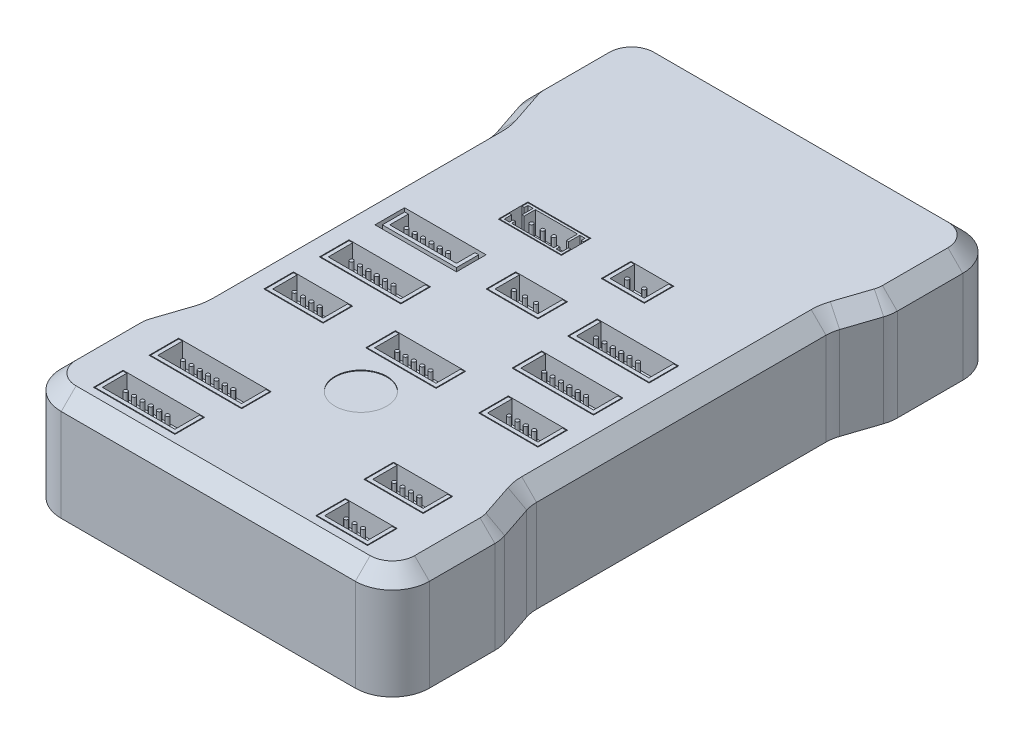
from build123d import *

# Parameters (mm, degrees)
BOSS_EXTRUDE1_DEPTH  = 16
CHAMFER2_SIZE        = 2
CHAMFER3_SIZE        = 3.5
CHAMFER3_SIZE2       = 1.5
CUT_EXTRUDE2_DEPTH   = 0.5
SKETCH5_W            = 8.5
SKETCH5_H            = 4
SKETCH5_W_2          = 5.8
SKETCH5_W_3          = 11
SKETCH5_W_4          = 7
SKETCH5_W_5          = 8
SKETCH5_W_6          = 9.5
SKETCH5_W_7          = 12.5
CUT_EXTRUDE3_DEPTH   = 4
BOSS_EXTRUDE2_DEPTH  = 4
SKETCH7_W            = 8.3
SKETCH7_H            = 3.8
BOSS_EXTRUDE3_DEPTH  = 1
SKETCH8_R            = 0.25
BOSS_EXTRUDE4_DEPTH  = 3
BOSS_EXTRUDE5_DEPTH  = 4
BOSS_EXTRUDE6_DEPTH  = 1
SKETCH11_R           = 0.25
BOSS_EXTRUDE7_DEPTH  = 3
SKETCH12_W           = 10
SKETCH12_H           = 3
BOSS_EXTRUDE8_DEPTH  = 1
BOSS_EXTRUDE9_DEPTH  = 3
SKETCH14_R           = 0.25
BOSS_EXTRUDE10_DEPTH = 3
SKETCH15_W           = 6.8
SKETCH15_H           = 3.8
BOSS_EXTRUDE11_DEPTH = 1
BOSS_EXTRUDE12_DEPTH = 3
SKETCH17_R           = 0.25
BOSS_EXTRUDE13_DEPTH = 3
SKETCH18_W           = 10.8
SKETCH18_H           = 3.8
BOSS_EXTRUDE14_DEPTH = 1
BOSS_EXTRUDE15_DEPTH = 3
SKETCH20_R           = 0.25
SKETCH20_R_2         = 0.247012806
SKETCH20_R_3         = 0.247012796
BOSS_EXTRUDE16_DEPTH = 3
SKETCH22_W           = 10.8
SKETCH22_H           = 3.8
BOSS_EXTRUDE17_DEPTH = 1
BOSS_EXTRUDE18_DEPTH = 3
SKETCH24_R           = 0.25
BOSS_EXTRUDE19_DEPTH = 3
SKETCH25_W           = 10.8
SKETCH25_H           = 3.8
BOSS_EXTRUDE20_DEPTH = 1
BOSS_EXTRUDE21_DEPTH = 3
SKETCH27_R           = 0.25
BOSS_EXTRUDE22_DEPTH = 3
SKETCH28_W           = 7.8
SKETCH28_H           = 3.8
BOSS_EXTRUDE23_DEPTH = 1
BOSS_EXTRUDE24_DEPTH = 3
SKETCH30_R           = 0.25
BOSS_EXTRUDE25_DEPTH = 3
SKETCH31_W           = 9.3
SKETCH31_H           = 3.8
BOSS_EXTRUDE26_DEPTH = 1
BOSS_EXTRUDE27_DEPTH = 3
SKETCH33_R           = 0.25
BOSS_EXTRUDE28_DEPTH = 3
SKETCH34_W           = 7.8
SKETCH34_H           = 3.8
BOSS_EXTRUDE29_DEPTH = 1
BOSS_EXTRUDE30_DEPTH = 3
SKETCH36_R           = 0.25
BOSS_EXTRUDE31_DEPTH = 3
SKETCH37_W           = 12.3
SKETCH37_H           = 3.8
BOSS_EXTRUDE32_DEPTH = 1
BOSS_EXTRUDE33_DEPTH = 3
SKETCH39_R           = 0.25
BOSS_EXTRUDE34_DEPTH = 3
SKETCH40_W           = 7.8
SKETCH40_H           = 3.8
BOSS_EXTRUDE35_DEPTH = 1
BOSS_EXTRUDE36_DEPTH = 3
SKETCH42_R           = 0.25
BOSS_EXTRUDE37_DEPTH = 3
SKETCH43_W           = 10.8
SKETCH43_H           = 3.8
BOSS_EXTRUDE38_DEPTH = 1
BOSS_EXTRUDE39_DEPTH = 3
SKETCH45_R           = 0.25
BOSS_EXTRUDE40_DEPTH = 3
SKETCH46_W           = 6.8
SKETCH46_H           = 3.8
BOSS_EXTRUDE41_DEPTH = 1
BOSS_EXTRUDE42_DEPTH = 3
SKETCH48_R           = 0.25
BOSS_EXTRUDE43_DEPTH = 3
SKETCH49_R           = 3.5
CUT_EXTRUDE4_DEPTH   = 0.1
SKETCH51_W           = 39.7
SKETCH51_H           = 9
CUT_EXTRUDE5_DEPTH   = 7
SKETCH52_R           = 0.25
BOSS_EXTRUDE46_DEPTH = 7
L_EK1_SCALE          = 0.5


with BuildPart() as part:
    # Sketch1 → Boss-Extrude1 (new body)
    with BuildSketch(Plane(origin=(0, 0, 0), x_dir=(1, 0, 0), z_dir=(0, 1, 0))):
        with BuildLine():
            Line((-19.85, 41), (19.85, 41))
            ThreePointArc((19.85, 41), (23.385533906, 39.535533906), (24.85, 36))
            Line((24.85, 36), (24.85, 27.161388301))
            ThreePointArc((24.85, 27.161388301), (24.785437288, 26.360477086), (24.59341649, 25.580249471))
            Line((24.59341649, 25.580249471), (23.10658351, 21.119750529))
            ThreePointArc((23.10658351, 21.119750529), (22.914562712, 20.339522914), (22.85, 19.538611699))
            Line((22.85, 19.538611699), (22.85, -19.538611699))
            ThreePointArc((22.85, -19.538611699), (22.914562712, -20.339522914), (23.10658351, -21.119750529))
            Line((23.10658351, -21.119750529), (24.59341649, -25.580249471))
            ThreePointArc((24.59341649, -25.580249471), (24.785437288, -26.360477086), (24.85, -27.161388301))
            Line((24.85, -27.161388301), (24.85, -36))
            ThreePointArc((24.85, -36), (23.385533906, -39.535533906), (19.85, -41))
            Line((19.85, -41), (-19.85, -41))
            ThreePointArc((-19.85, -41), (-23.385533906, -39.535533906), (-24.85, -36))
            Line((-24.85, -36), (-24.85, -27.161388301))
            ThreePointArc((-24.85, -27.161388301), (-24.785437288, -26.360477086), (-24.59341649, -25.580249471))
            Line((-24.59341649, -25.580249471), (-23.10658351, -21.119750529))
            ThreePointArc((-23.10658351, -21.119750529), (-22.914562712, -20.339522914), (-22.85, -19.538611699))
            Line((-22.85, -19.538611699), (-22.85, 19.538611699))
            ThreePointArc((-22.85, 19.538611699), (-22.914562712, 20.339522914), (-23.10658351, 21.119750529))
            Line((-23.10658351, 21.119750529), (-24.59341649, 25.580249471))
            ThreePointArc((-24.59341649, 25.580249471), (-24.785437288, 26.360477086), (-24.85, 27.161388301))
            Line((-24.85, 27.161388301), (-24.85, 36))
            ThreePointArc((-24.85, 36), (-23.385533906, 39.535533906), (-19.85, 41))
        make_face()
    extrude(amount=BOSS_EXTRUDE1_DEPTH)

    # Chamfer2
    chamfer2_edges = [part.edges().sort_by_distance(p)[0] for p in [
        (22.914562712, 16, 20.339522914),
        (22.85, 16, 0),
        (23.85, 16, 23.35),
        (22.914562712, 16, -20.339522914),
        (24.785437288, 16, 26.360477086),
        (23.85, 16, -23.35),
        (24.85, 16, 31.58069415),
        (24.785437288, 16, -26.360477086),
        (23.385533906, 16, 39.535533906),
        (24.85, 16, -31.58069415),
        (0, 16, 41),
        (23.385533906, 16, -39.535533906),
        (-23.385533906, 16, 39.535533906),
        (0, 16, -41),
        (-24.85, 16, 31.58069415),
        (-23.385533906, 16, -39.535533906),
        (-24.785437288, 16, 26.360477086),
        (-24.85, 16, -31.58069415),
        (-23.85, 16, 23.35),
        (-24.785437288, 16, -26.360477086),
        (-22.914562712, 16, 20.339522914),
        (-23.85, 16, -23.35),
        (-22.85, 16, 0),
        (-22.914562712, 16, -20.339522914),
    ]]
    chamfer(chamfer2_edges, length=CHAMFER2_SIZE)

    # Chamfer3
    chamfer3_edges = [part.edges().sort_by_distance(p)[0] for p in [
        (24.85, 0, -31.58069415),
        (24.785437288, 0, -26.360477086),
        (23.85, 0, -23.35),
        (22.914562712, 0, -20.339522914),
        (22.85, 0, 0),
        (22.914562712, 0, 20.339522914),
        (23.85, 0, 23.35),
        (24.785437288, 0, 26.360477086),
        (24.85, 0, 31.58069415),
        (23.385533906, 0, 39.535533906),
        (0, 0, 41),
        (-23.385533906, 0, 39.535533906),
        (-24.85, 0, 31.58069415),
        (-24.785437288, 0, 26.360477086),
        (-23.85, 0, 23.35),
        (-22.914562712, 0, 20.339522914),
        (-22.85, 0, 0),
        (-22.914562712, 0, -20.339522914),
        (-23.85, 0, -23.35),
        (-24.785437288, 0, -26.360477086),
        (-24.85, 0, -31.58069415),
        (-23.385533906, 0, -39.535533906),
        (0, 0, -41),
        (23.385533906, 0, -39.535533906),
    ]]
    chamfer3_side = [part.faces().sort_by_distance(p)[0] for p in [
        (0, 0, 0),
    ]]
    chamfer(chamfer3_edges, length=CHAMFER3_SIZE, length2=CHAMFER3_SIZE2, reference=chamfer3_side[0])

    # Sketch4 → Cut-Extrude2 (cut)
    with BuildSketch(Plane.XZ):
        with BuildLine():
            Line((-18.35, 36.5), (-12.35, 36.5))
            ThreePointArc((-12.35, 36.5), (-10.935786438, 35.914213562), (-10.35, 34.5))
            Line((-10.35, 34.5), (-10.35, 28.5))
            ThreePointArc((-10.35, 28.5), (-10.935786438, 27.085786438), (-12.35, 26.5))
            Line((-12.35, 26.5), (-18.35, 26.5))
            ThreePointArc((-18.35, 26.5), (-19.764213562, 27.085786438), (-20.35, 28.5))
            Line((-20.35, 28.5), (-20.35, 34.5))
            ThreePointArc((-20.35, 34.5), (-19.764213562, 35.914213562), (-18.35, 36.5))
        make_face()
        with BuildLine():
            Line((18.35, 26.5), (12.35, 26.5))
            ThreePointArc((12.35, 26.5), (10.935786438, 27.085786438), (10.35, 28.5))
            Line((10.35, 28.5), (10.35, 34.5))
            ThreePointArc((10.35, 34.5), (10.935786438, 35.914213562), (12.35, 36.5))
            Line((12.35, 36.5), (18.35, 36.5))
            ThreePointArc((18.35, 36.5), (19.764213562, 35.914213562), (20.35, 34.5))
            Line((20.35, 34.5), (20.35, 28.5))
            ThreePointArc((20.35, 28.5), (19.764213562, 27.085786438), (18.35, 26.5))
        make_face()
        with BuildLine():
            Line((20.35, -34.5), (20.35, -28.5))
            ThreePointArc((20.35, -28.5), (19.764213562, -27.085786438), (18.35, -26.5))
            Line((18.35, -26.5), (12.35, -26.5))
            ThreePointArc((12.35, -26.5), (10.935786438, -27.085786438), (10.35, -28.5))
            Line((10.35, -28.5), (10.35, -34.5))
            ThreePointArc((10.35, -34.5), (10.935786438, -35.914213562), (12.35, -36.5))
            Line((12.35, -36.5), (18.35, -36.5))
            ThreePointArc((18.35, -36.5), (19.764213562, -35.914213562), (20.35, -34.5))
        make_face()
        with BuildLine():
            Line((-18.35, -26.5), (-12.35, -26.5))
            ThreePointArc((-12.35, -26.5), (-10.935786438, -27.085786438), (-10.35, -28.5))
            Line((-10.35, -28.5), (-10.35, -34.5))
            ThreePointArc((-10.35, -34.5), (-10.935786438, -35.914213562), (-12.35, -36.5))
            Line((-12.35, -36.5), (-18.35, -36.5))
            ThreePointArc((-18.35, -36.5), (-19.764213562, -35.914213562), (-20.35, -34.5))
            Line((-20.35, -34.5), (-20.35, -28.5))
            ThreePointArc((-20.35, -28.5), (-19.764213562, -27.085786438), (-18.35, -26.5))
        make_face()
        with BuildLine():
            Line((-10.75, 17.75), (10.75, 17.75))
            ThreePointArc((10.75, 17.75), (12.164213562, 17.164213562), (12.75, 15.75))
            Line((12.75, 15.75), (12.75, -15.75))
            ThreePointArc((12.75, -15.75), (12.164213562, -17.164213562), (10.75, -17.75))
            Line((10.75, -17.75), (-10.75, -17.75))
            ThreePointArc((-10.75, -17.75), (-12.164213562, -17.164213562), (-12.75, -15.75))
            Line((-12.75, -15.75), (-12.75, 15.75))
            ThreePointArc((-12.75, 15.75), (-12.164213562, 17.164213562), (-10.75, 17.75))
        make_face()
    extrude(amount=-CUT_EXTRUDE2_DEPTH, mode=Mode.SUBTRACT)

    # Sketch5 → Cut-Extrude3 (cut)
    with BuildSketch(Plane(origin=(0, 16, 0), x_dir=(1, 0, 0), z_dir=(0, 1, 0))):
        with Locations((-6.6, 11)):
            Rectangle(SKETCH5_W, SKETCH5_H)
        with Locations((5.95, 11)):
            Rectangle(SKETCH5_W_2, SKETCH5_H)
        with Locations((-13, -5.5)):
            Rectangle(SKETCH5_W_3, SKETCH5_H)
        with Locations((-13, 2)):
            Rectangle(SKETCH5_W_3, SKETCH5_H)
        with Locations((0, 2)):
            Rectangle(SKETCH5_W_4, SKETCH5_H)
        with Locations((13, 2)):
            Rectangle(SKETCH5_W_3, SKETCH5_H)
        with Locations((13, -5.5)):
            Rectangle(SKETCH5_W_3, SKETCH5_H)
        with Locations((-14.5, -13)):
            Rectangle(SKETCH5_W_5, SKETCH5_H)
        with Locations((0, -13)):
            Rectangle(SKETCH5_W_6, SKETCH5_H)
        with Locations((14.5, -13)):
            Rectangle(SKETCH5_W_5, SKETCH5_H)
        with Locations((-13, -36)):
            Rectangle(SKETCH5_W_3, SKETCH5_H)
        with Locations((-12.25, -28.5)):
            Rectangle(SKETCH5_W_7, SKETCH5_H)
        with Locations((14.5, -28.5)):
            Rectangle(SKETCH5_W_5, SKETCH5_H)
        with Locations((15, -36)):
            Rectangle(SKETCH5_W_4, SKETCH5_H)
    extrude(amount=-CUT_EXTRUDE3_DEPTH, mode=Mode.SUBTRACT)

    # Sketch6 → Boss-Extrude2 (add)
    with BuildSketch(Plane(origin=(0, 12, 0), x_dir=(1, 0, 0), z_dir=(0, 1, 0))):
        Polygon((-9.75, 11.1), (-9.45, 11.1), (-9.45, 12.6), (-3.75, 12.6), (-3.75, 11.1), (-3.45, 11.1), (-3.45, 12.6), (-2.75, 12.6), (-2.75, 12.1), (-2.45, 12.1), (-2.45, 12.9), (-10.75, 12.9), (-10.75, 12.1), (-10.45, 12.1), (-10.45, 12.6), (-9.75, 12.6), align=None)
        Polygon((-3.45, 9.4), (-2.75, 9.4), (-2.75, 10.4), (-2.45, 10.4), (-2.45, 9.1), (-10.75, 9.1), (-10.75, 10.4), (-10.45, 10.4), (-10.45, 9.4), (-9.75, 9.4), (-9.75, 9.9), (-9.45, 9.9), (-9.45, 9.4), (-3.75, 9.4), (-3.75, 9.9), (-3.45, 9.9), align=None)
    extrude(amount=BOSS_EXTRUDE2_DEPTH)

    # Sketch7 → Boss-Extrude3 (add)
    with BuildSketch(Plane(origin=(0, 12, 0), x_dir=(1, 0, 0), z_dir=(0, 1, 0))):
        with Locations((-6.6, 11)):
            Rectangle(SKETCH7_W, SKETCH7_H)
    extrude(amount=BOSS_EXTRUDE3_DEPTH)

    # Sketch8 → Boss-Extrude4 (add)
    with BuildSketch(Plane(origin=(0, 13, 0), x_dir=(1, 0, 0), z_dir=(0, 1, 0))):
        with Locations(Location((-6.6, 10.75, 0), (0, 0, 90))):
            Circle(SKETCH8_R)
        with Locations(Location((-5.1, 10.75, 0), (0, 0, 90))):
            Circle(SKETCH8_R)
        with Locations(Location((-8.1, 10.75, 0), (0, 0, 90))):
            Circle(SKETCH8_R)
    extrude(amount=BOSS_EXTRUDE4_DEPTH)

    # Sketch9 → Boss-Extrude5 (add)
    with BuildSketch(Plane(origin=(0, 12, 0), x_dir=(1, 0, 0), z_dir=(0, 1, 0))):
        Polygon((8.75, 12.9), (8.25, 12.9), (8.25, 9.6), (3.65, 9.6), (3.65, 12.9), (3.15, 12.9), (3.15, 9.1), (8.75, 9.1), align=None)
    extrude(amount=BOSS_EXTRUDE5_DEPTH)

    # Sketch10 → Boss-Extrude6 (add)
    with BuildSketch(Plane(origin=(0, 12, 0), x_dir=(1, 0, 0), z_dir=(0, 1, 0))):
        Polygon((8.75, 12.9), (8.75, 9.1), (3.15, 9.1), (3.15, 12.9), (3.65, 12.9), align=None)
    extrude(amount=BOSS_EXTRUDE6_DEPTH)

    # Sketch11 → Boss-Extrude7 (add)
    with BuildSketch(Plane(origin=(0, 13, 0), x_dir=(1, 0, 0), z_dir=(0, 1, 0))):
        with Locations(Location((4.8, 10.75, 0), (0, 0, 90))):
            Circle(SKETCH11_R)
        with Locations(Location((7.1, 10.75, 0), (0, 0, 90))):
            Circle(SKETCH11_R)
    extrude(amount=BOSS_EXTRUDE7_DEPTH)

    # Sketch12 → Boss-Extrude8 (add)
    with BuildSketch(Plane(origin=(0, 12, 0), x_dir=(1, 0, 0), z_dir=(0, 1, 0))):
        with Locations((-13, 2)):
            Rectangle(SKETCH12_W, SKETCH12_H)
    extrude(amount=BOSS_EXTRUDE8_DEPTH)

    # Sketch13 → Boss-Extrude9 (add)
    with BuildSketch(Plane(origin=(0, 13, 0), x_dir=(1, 0, 0), z_dir=(0, 1, 0))):
        Polygon((-18, 3.5), (-18, 0.5), (-8, 0.5), (-8, 3.5), (-8.5, 3.5), (-8.5, 1), (-17.5, 1), (-17.5, 3.5), align=None)
    extrude(amount=BOSS_EXTRUDE9_DEPTH)

    # Sketch14 → Boss-Extrude10 (add)
    with BuildSketch(Plane(origin=(0, 13, 0), x_dir=(1, 0, 0), z_dir=(0, 1, 0))):
        with Locations(Location((-16, 1.75, 0), (0, 0, 90))):
            Circle(SKETCH14_R)
        with Locations(Location((-14.875, 1.75, 0), (0, 0, 90))):
            Circle(SKETCH14_R)
        with Locations(Location((-13.75, 1.75, 0), (0, 0, 90))):
            Circle(SKETCH14_R)
        with Locations(Location((-12.625, 1.75, 0), (0, 0, 90))):
            Circle(SKETCH14_R)
        with Locations(Location((-11.5, 1.75, 0), (0, 0, 90))):
            Circle(SKETCH14_R)
        with Locations(Location((-10.375, 1.75, 0), (0, 0, 90))):
            Circle(SKETCH14_R)
    extrude(amount=BOSS_EXTRUDE10_DEPTH)

    # Sketch15 → Boss-Extrude11 (add)
    with BuildSketch(Plane(origin=(0, 12, 0), x_dir=(1, 0, 0), z_dir=(0, 1, 0))):
        with Locations((0, 2)):
            Rectangle(SKETCH15_W, SKETCH15_H)
    extrude(amount=BOSS_EXTRUDE11_DEPTH)

    # Sketch16 → Boss-Extrude12 (add)
    with BuildSketch(Plane(origin=(0, 13, 0), x_dir=(1, 0, 0), z_dir=(0, 1, 0))):
        Polygon((-3.4, 0.1), (-3.4, 3.9), (-2.9, 3.9), (-2.9, 0.6), (2.9, 0.6), (2.9, 3.9), (3.4, 3.9), (3.4, 0.1), align=None)
    extrude(amount=BOSS_EXTRUDE12_DEPTH)

    # Sketch17 → Boss-Extrude13 (add)
    with BuildSketch(Plane(origin=(0, 13, 0), x_dir=(1, 0, 0), z_dir=(0, 1, 0))):
        with Locations(Location((0, 1.75, 0), (0, 0, 90))):
            Circle(SKETCH17_R)
        with Locations(Location((-1.5, 1.75, 0), (0, 0, 90))):
            Circle(SKETCH17_R)
        with Locations(Location((1.5, 1.75, 0), (0, 0, 90))):
            Circle(SKETCH17_R)
    extrude(amount=BOSS_EXTRUDE13_DEPTH)

    # Sketch18 → Boss-Extrude14 (add)
    with BuildSketch(Plane(origin=(0, 12, 0), x_dir=(1, 0, 0), z_dir=(0, 1, 0))):
        with Locations((13, 2)):
            Rectangle(SKETCH18_W, SKETCH18_H)
    extrude(amount=BOSS_EXTRUDE14_DEPTH)

    # Sketch19 → Boss-Extrude15 (add)
    with BuildSketch(Plane(origin=(0, 13, 0), x_dir=(1, 0, 0), z_dir=(0, 1, 0))):
        Polygon((7.6, 0.1), (7.6, 3.9), (8.1, 3.9), (8.1, 0.6), (17.9, 0.6), (17.9, 3.9), (18.4, 3.9), (18.4, 0.1), align=None)
    extrude(amount=BOSS_EXTRUDE15_DEPTH)

    # Sketch20 → Boss-Extrude16 (add)
    with BuildSketch(Plane(origin=(0, 13, 0), x_dir=(1, 0, 0), z_dir=(0, 1, 0))):
        with Locations(Location((14.122334432, 1.747012796, 0), (0, 0, 90))):
            Circle(SKETCH20_R)
        with Locations(Location((15.252334432, 1.747012796, 0), (0, 0, 90))):
            Circle(SKETCH20_R)
        with Locations(Location((11.862334432, 1.74999999, 0), (0, 0, 90))):
            Circle(SKETCH20_R_2)
        with Locations(Location((10.732338381, 1.747012796, 0), (0, 0, 90))):
            Circle(SKETCH20_R)
        with Locations(Location((12.992334432, 1.75, 0), (0, 0, 90))):
            Circle(SKETCH20_R_3)
        with Locations(Location((9.6, 1.747012796, 0), (0, 0, 90))):
            Circle(SKETCH20_R)
    extrude(amount=BOSS_EXTRUDE16_DEPTH)

    # Sketch22 → Boss-Extrude17 (add)
    with BuildSketch(Plane(origin=(0, 12, 0), x_dir=(1, 0, 0), z_dir=(0, 1, 0))):
        with Locations((-13, -5.5)):
            Rectangle(SKETCH22_W, SKETCH22_H)
    extrude(amount=BOSS_EXTRUDE17_DEPTH)

    # Sketch23 → Boss-Extrude18 (add)
    with BuildSketch(Plane(origin=(0, 13, 0), x_dir=(1, 0, 0), z_dir=(0, 1, 0))):
        Polygon((-18.4, -7.4), (-18.4, -3.6), (-17.9, -3.6), (-17.9, -6.9), (-8.1, -6.9), (-8.1, -3.6), (-7.6, -3.6), (-7.6, -7.4), align=None)
    extrude(amount=BOSS_EXTRUDE18_DEPTH)

    # Sketch24 → Boss-Extrude19 (add)
    with BuildSketch(Plane(origin=(0, 13, 0), x_dir=(1, 0, 0), z_dir=(0, 1, 0))):
        with Locations(Location((-15.9, -5.75, 0), (0, 0, 90))):
            Circle(SKETCH24_R)
        with Locations(Location((-14.77, -5.75, 0), (0, 0, 90))):
            Circle(SKETCH24_R)
        with Locations(Location((-13.64, -5.75, 0), (0, 0, 90))):
            Circle(SKETCH24_R)
        with Locations(Location((-12.51, -5.75, 0), (0, 0, 90))):
            Circle(SKETCH24_R)
        with Locations(Location((-11.38, -5.75, 0), (0, 0, 90))):
            Circle(SKETCH24_R)
        with Locations(Location((-10.25, -5.75, 0), (0, 0, 90))):
            Circle(SKETCH24_R)
    extrude(amount=BOSS_EXTRUDE19_DEPTH)

    # Sketch25 → Boss-Extrude20 (add)
    with BuildSketch(Plane(origin=(0, 12, 0), x_dir=(1, 0, 0), z_dir=(0, 1, 0))):
        with Locations((13, -5.5)):
            Rectangle(SKETCH25_W, SKETCH25_H)
    extrude(amount=BOSS_EXTRUDE20_DEPTH)

    # Sketch26 → Boss-Extrude21 (add)
    with BuildSketch(Plane(origin=(0, 13, 0), x_dir=(1, 0, 0), z_dir=(0, 1, 0))):
        Polygon((7.6, -3.6), (7.6, -7.4), (18.4, -7.4), (18.4, -3.6), (17.9, -3.6), (17.9, -6.9), (8.1, -6.9), (8.1, -3.6), align=None)
    extrude(amount=BOSS_EXTRUDE21_DEPTH)

    # Sketch27 → Boss-Extrude22 (add)
    with BuildSketch(Plane(origin=(0, 13, 0), x_dir=(1, 0, 0), z_dir=(0, 1, 0))):
        with Locations(Location((10.1, -5.75, 0), (0, 0, 90))):
            Circle(SKETCH27_R)
        with Locations(Location((11.23, -5.75, 0), (0, 0, 90))):
            Circle(SKETCH27_R)
        with Locations(Location((12.36, -5.75, 0), (0, 0, 90))):
            Circle(SKETCH27_R)
        with Locations(Location((13.49, -5.75, 0), (0, 0, 90))):
            Circle(SKETCH27_R)
        with Locations(Location((14.62, -5.75, 0), (0, 0, 90))):
            Circle(SKETCH27_R)
        with Locations(Location((15.75, -5.75, 0), (0, 0, 90))):
            Circle(SKETCH27_R)
    extrude(amount=BOSS_EXTRUDE22_DEPTH)

    # Sketch28 → Boss-Extrude23 (add)
    with BuildSketch(Plane(origin=(0, 12, 0), x_dir=(1, 0, 0), z_dir=(0, 1, 0))):
        with Locations((-14.5, -13)):
            Rectangle(SKETCH28_W, SKETCH28_H)
    extrude(amount=BOSS_EXTRUDE23_DEPTH)

    # Sketch29 → Boss-Extrude24 (add)
    with BuildSketch(Plane(origin=(0, 13, 0), x_dir=(1, 0, 0), z_dir=(0, 1, 0))):
        Polygon((-18.4, -11.1), (-18.4, -14.9), (-10.6, -14.9), (-10.6, -11.1), (-11.1, -11.1), (-11.1, -14.4), (-17.9, -14.4), (-17.9, -11.1), align=None)
    extrude(amount=BOSS_EXTRUDE24_DEPTH)

    # Sketch30 → Boss-Extrude25 (add)
    with BuildSketch(Plane(origin=(0, 13, 0), x_dir=(1, 0, 0), z_dir=(0, 1, 0))):
        with Locations(Location((-16.1, -13.25, 0), (0, 0, 90))):
            Circle(SKETCH30_R)
        with Locations(Location((-14.97, -13.25, 0), (0, 0, 90))):
            Circle(SKETCH30_R)
        with Locations(Location((-13.84, -13.25, 0), (0, 0, 90))):
            Circle(SKETCH30_R)
        with Locations(Location((-12.71, -13.25, 0), (0, 0, 90))):
            Circle(SKETCH30_R)
    extrude(amount=BOSS_EXTRUDE25_DEPTH)

    # Sketch31 → Boss-Extrude26 (add)
    with BuildSketch(Plane(origin=(0, 12, 0), x_dir=(1, 0, 0), z_dir=(0, 1, 0))):
        with Locations((0, -13)):
            Rectangle(SKETCH31_W, SKETCH31_H)
    extrude(amount=BOSS_EXTRUDE26_DEPTH)

    # Sketch32 → Boss-Extrude27 (add)
    with BuildSketch(Plane(origin=(0, 13, 0), x_dir=(1, 0, 0), z_dir=(0, 1, 0))):
        Polygon((-4.65, -14.9), (-4.65, -11.1), (-4.15, -11.1), (-4.15, -14.4), (4.15, -14.4), (4.15, -11.1), (4.65, -11.1), (4.65, -14.9), align=None)
    extrude(amount=BOSS_EXTRUDE27_DEPTH)

    # Sketch33 → Boss-Extrude28 (add)
    with BuildSketch(Plane(origin=(0, 13, 0), x_dir=(1, 0, 0), z_dir=(0, 1, 0))):
        with Locations(Location((0, -13.25, 0), (0, 0, 90))):
            Circle(SKETCH33_R)
        with Locations(Location((1.13, -13.256476844, 0), (0, 0, 90))):
            Circle(SKETCH33_R)
        with Locations(Location((-1.13, -13.25, 0), (0, 0, 90))):
            Circle(SKETCH33_R)
        with Locations(Location((2.26, -13.262953689, 0), (0, 0, 90))):
            Circle(SKETCH33_R)
        with Locations(Location((-2.26, -13.237046311, 0), (0, 0, 90))):
            Circle(SKETCH33_R)
    extrude(amount=BOSS_EXTRUDE28_DEPTH)

    # Sketch34 → Boss-Extrude29 (add)
    with BuildSketch(Plane(origin=(0, 12, 0), x_dir=(1, 0, 0), z_dir=(0, 1, 0))):
        with Locations((14.5, -13)):
            Rectangle(SKETCH34_W, SKETCH34_H)
    extrude(amount=BOSS_EXTRUDE29_DEPTH)

    # Sketch35 → Boss-Extrude30 (add)
    with BuildSketch(Plane(origin=(0, 13, 0), x_dir=(1, 0, 0), z_dir=(0, 1, 0))):
        Polygon((10.6, -11.1), (10.6, -14.9), (18.4, -14.9), (18.4, -11.1), (17.9, -11.1), (17.9, -14.4), (11.1, -14.4), (11.1, -11.1), align=None)
    extrude(amount=BOSS_EXTRUDE30_DEPTH)

    # Sketch36 → Boss-Extrude31 (add)
    with BuildSketch(Plane(origin=(0, 13, 0), x_dir=(1, 0, 0), z_dir=(0, 1, 0))):
        with Locations(Location((12.85, -13.25, 0), (0, 0, 90))):
            Circle(SKETCH36_R)
        with Locations(Location((13.98, -13.25, 0), (0, 0, 90))):
            Circle(SKETCH36_R)
        with Locations(Location((15.11, -13.25, 0), (0, 0, 90))):
            Circle(SKETCH36_R)
        with Locations(Location((16.24, -13.25, 0), (0, 0, 90))):
            Circle(SKETCH36_R)
    extrude(amount=BOSS_EXTRUDE31_DEPTH)

    # Sketch37 → Boss-Extrude32 (add)
    with BuildSketch(Plane(origin=(0, 12, 0), x_dir=(1, 0, 0), z_dir=(0, 1, 0))):
        with Locations((-12.25, -28.5)):
            Rectangle(SKETCH37_W, SKETCH37_H)
    extrude(amount=BOSS_EXTRUDE32_DEPTH)

    # Sketch38 → Boss-Extrude33 (add)
    with BuildSketch(Plane(origin=(0, 13, 0), x_dir=(1, 0, 0), z_dir=(0, 1, 0))):
        Polygon((-18.4, -26.6), (-18.4, -30.4), (-6.1, -30.4), (-6.1, -26.6), (-6.6, -26.6), (-6.6, -29.9), (-17.9, -29.9), (-17.9, -26.6), align=None)
    extrude(amount=BOSS_EXTRUDE33_DEPTH)

    # Sketch39 → Boss-Extrude34 (add)
    with BuildSketch(Plane(origin=(0, 13, 0), x_dir=(1, 0, 0), z_dir=(0, 1, 0))):
        with Locations(Location((-12.25, -28.77382246, 0), (0, 0, 90))):
            Circle(SKETCH39_R)
        with Locations(Location((-11.12, -28.77382246, 0), (0, 0, 90))):
            Circle(SKETCH39_R)
        with Locations(Location((-14.51, -28.77382246, 0), (0, 0, 90))):
            Circle(SKETCH39_R)
        with Locations(Location((-13.38, -28.77382246, 0), (0, 0, 90))):
            Circle(SKETCH39_R)
        with Locations(Location((-9.99, -28.77382246, 0), (0, 0, 90))):
            Circle(SKETCH39_R)
        with Locations(Location((-8.86, -28.77382246, 0), (0, 0, 90))):
            Circle(SKETCH39_R)
        with Locations(Location((-15.64, -28.77382246, 0), (0, 0, 90))):
            Circle(SKETCH39_R)
    extrude(amount=BOSS_EXTRUDE34_DEPTH)

    # Sketch40 → Boss-Extrude35 (add)
    with BuildSketch(Plane(origin=(0, 12, 0), x_dir=(1, 0, 0), z_dir=(0, 1, 0))):
        with Locations((14.5, -28.5)):
            Rectangle(SKETCH40_W, SKETCH40_H)
    extrude(amount=BOSS_EXTRUDE35_DEPTH)

    # Sketch41 → Boss-Extrude36 (add)
    with BuildSketch(Plane(origin=(0, 13, 0), x_dir=(1, 0, 0), z_dir=(0, 1, 0))):
        Polygon((10.6, -30.4), (10.6, -26.6), (11.1, -26.6), (11.1, -29.9), (17.9, -29.9), (17.9, -26.6), (18.4, -26.6), (18.4, -30.4), align=None)
    extrude(amount=BOSS_EXTRUDE36_DEPTH)

    # Sketch42 → Boss-Extrude37 (add)
    with BuildSketch(Plane(origin=(0, 13, 0), x_dir=(1, 0, 0), z_dir=(0, 1, 0))):
        with Locations(Location((12.85, -28.75, 0), (0, 0, 90))):
            Circle(SKETCH42_R)
        with Locations(Location((13.98, -28.75, 0), (0, 0, 90))):
            Circle(SKETCH42_R)
        with Locations(Location((15.11, -28.75, 0), (0, 0, 90))):
            Circle(SKETCH42_R)
        with Locations(Location((16.24, -28.75, 0), (0, 0, 90))):
            Circle(SKETCH42_R)
    extrude(amount=BOSS_EXTRUDE37_DEPTH)

    # Sketch43 → Boss-Extrude38 (add)
    with BuildSketch(Plane(origin=(0, 12, 0), x_dir=(1, 0, 0), z_dir=(0, 1, 0))):
        with Locations((-13, -36)):
            Rectangle(SKETCH43_W, SKETCH43_H)
    extrude(amount=BOSS_EXTRUDE38_DEPTH)

    # Sketch44 → Boss-Extrude39 (add)
    with BuildSketch(Plane(origin=(0, 13, 0), x_dir=(1, 0, 0), z_dir=(0, 1, 0))):
        Polygon((-18.4, -34.1), (-18.4, -37.9), (-7.6, -37.9), (-7.6, -34.1), (-8.1, -34.1), (-8.1, -37.4), (-17.9, -37.4), (-17.9, -34.1), align=None)
    extrude(amount=BOSS_EXTRUDE39_DEPTH)

    # Sketch45 → Boss-Extrude40 (add)
    with BuildSketch(Plane(origin=(0, 13, 0), x_dir=(1, 0, 0), z_dir=(0, 1, 0))):
        with Locations(Location((-15.9, -36.25, 0), (0, 0, 90))):
            Circle(SKETCH45_R)
        with Locations(Location((-14.77, -36.25, 0), (0, 0, 90))):
            Circle(SKETCH45_R)
        with Locations(Location((-13.64, -36.25, 0), (0, 0, 90))):
            Circle(SKETCH45_R)
        with Locations(Location((-12.51, -36.25, 0), (0, 0, 90))):
            Circle(SKETCH45_R)
        with Locations(Location((-11.38, -36.25, 0), (0, 0, 90))):
            Circle(SKETCH45_R)
        with Locations(Location((-10.25, -36.25, 0), (0, 0, 90))):
            Circle(SKETCH45_R)
    extrude(amount=BOSS_EXTRUDE40_DEPTH)

    # Sketch46 → Boss-Extrude41 (add)
    with BuildSketch(Plane(origin=(0, 12, 0), x_dir=(1, 0, 0), z_dir=(0, 1, 0))):
        with Locations((15, -36)):
            Rectangle(SKETCH46_W, SKETCH46_H)
    extrude(amount=BOSS_EXTRUDE41_DEPTH)

    # Sketch47 → Boss-Extrude42 (add)
    with BuildSketch(Plane(origin=(0, 13, 0), x_dir=(1, 0, 0), z_dir=(0, 1, 0))):
        Polygon((11.6, -34.1), (11.6, -37.9), (18.4, -37.9), (18.4, -34.1), (17.9, -34.1), (17.9, -37.4), (12.1, -37.4), (12.1, -34.1), align=None)
    extrude(amount=BOSS_EXTRUDE42_DEPTH)

    # Sketch48 → Boss-Extrude43 (add)
    with BuildSketch(Plane(origin=(0, 13, 0), x_dir=(1, 0, 0), z_dir=(0, 1, 0))):
        with Locations(Location((13.87, -36.25, 0), (0, 0, 90))):
            Circle(SKETCH48_R)
        with Locations(Location((15, -36.25, 0), (0, 0, 90))):
            Circle(SKETCH48_R)
        with Locations(Location((16.13, -36.25, 0), (0, 0, 90))):
            Circle(SKETCH48_R)
    extrude(amount=BOSS_EXTRUDE43_DEPTH)

    # Sketch49 → Cut-Extrude4 (cut)
    with BuildSketch(Plane(origin=(0, 16, 0), x_dir=(1, 0, 0), z_dir=(0, 1, 0))):
        with Locations(Location((0, -20.4, 0), (0, 0, 270))):
            Circle(SKETCH49_R)
    extrude(amount=-CUT_EXTRUDE4_DEPTH, mode=Mode.SUBTRACT)

    # Sketch51 → Cut-Extrude5 (cut)
    with BuildSketch(Plane(origin=(0, 0, -41), x_dir=(-1, 0, 0), z_dir=(0, 0, -1))):
        with Locations((0, 6)):
            Rectangle(SKETCH51_W, SKETCH51_H)
    extrude(amount=-CUT_EXTRUDE5_DEPTH, mode=Mode.SUBTRACT)

    # Sketch52 → Boss-Extrude46 (add)
    with BuildSketch(Plane(origin=(0, 0, -34), x_dir=(-1, 0, 0), z_dir=(0, 0, -1))):
        with Locations(Location((-18.609375, 9.259375, 0), (0, 0, 180))):
            Circle(SKETCH52_R)
        with Locations(Location((-18.609375, 6, 0), (0, 0, 180))):
            Circle(SKETCH52_R)
        with Locations(Location((-18.609375, 2.740625, 0), (0, 0, 180))):
            Circle(SKETCH52_R)
        with Locations(Location((-16.129375, 9.259375, 0), (0, 0, 180))):
            Circle(SKETCH52_R)
        with Locations(Location((-16.129375, 6, 0), (0, 0, 180))):
            Circle(SKETCH52_R)
        with Locations(Location((-16.129375, 2.740625, 0), (0, 0, 180))):
            Circle(SKETCH52_R)
        with Locations(Location((-13.649375, 2.740625, 0), (0, 0, 180))):
            Circle(SKETCH52_R)
        with Locations(Location((-13.649375, 6, 0), (0, 0, 180))):
            Circle(SKETCH52_R)
        with Locations(Location((-13.649375, 9.259375, 0), (0, 0, 180))):
            Circle(SKETCH52_R)
        with Locations(Location((-11.169375, 9.259375, 0), (0, 0, 180))):
            Circle(SKETCH52_R)
        with Locations(Location((-11.169375, 6, 0), (0, 0, 180))):
            Circle(SKETCH52_R)
        with Locations(Location((-8.689375, 2.740625, 0), (0, 0, 180))):
            Circle(SKETCH52_R)
        with Locations(Location((-6.209375, 2.740625, 0), (0, 0, 180))):
            Circle(SKETCH52_R)
        with Locations(Location((-6.209375, 6, 0), (0, 0, 180))):
            Circle(SKETCH52_R)
        with Locations(Location((-6.209375, 9.259375, 0), (0, 0, 180))):
            Circle(SKETCH52_R)
        with Locations(Location((-3.729375, 9.259375, 0), (0, 0, 180))):
            Circle(SKETCH52_R)
        with Locations(Location((-3.729375, 6, 0), (0, 0, 180))):
            Circle(SKETCH52_R)
        with Locations(Location((-3.729375, 2.740625, 0), (0, 0, 180))):
            Circle(SKETCH52_R)
        with Locations(Location((-1.249375, 2.740625, 0), (0, 0, 180))):
            Circle(SKETCH52_R)
        with Locations(Location((-1.249375, 6, 0), (0, 0, 180))):
            Circle(SKETCH52_R)
        with Locations(Location((-1.249375, 9.259375, 0), (0, 0, 180))):
            Circle(SKETCH52_R)
        with Locations(Location((1.230625, 9.259375, 0), (0, 0, 180))):
            Circle(SKETCH52_R)
        with Locations(Location((1.230625, 6, 0), (0, 0, 180))):
            Circle(SKETCH52_R)
        with Locations(Location((1.230625, 2.740625, 0), (0, 0, 180))):
            Circle(SKETCH52_R)
        with Locations(Location((3.710625, 9.259375, 0), (0, 0, 180))):
            Circle(SKETCH52_R)
        with Locations(Location((3.710625, 2.740625, 0), (0, 0, 180))):
            Circle(SKETCH52_R)
        with Locations(Location((6.190625, 2.740625, 0), (0, 0, 180))):
            Circle(SKETCH52_R)
        with Locations(Location((6.190625, 6, 0), (0, 0, 180))):
            Circle(SKETCH52_R)
        with Locations(Location((6.190625, 9.259375, 0), (0, 0, 180))):
            Circle(SKETCH52_R)
        with Locations(Location((8.670625, 9.259375, 0), (0, 0, 180))):
            Circle(SKETCH52_R)
        with Locations(Location((8.670625, 6, 0), (0, 0, 180))):
            Circle(SKETCH52_R)
        with Locations(Location((8.670625, 2.740625, 0), (0, 0, 180))):
            Circle(SKETCH52_R)
        with Locations(Location((11.150625, 2.740625, 0), (0, 0, 180))):
            Circle(SKETCH52_R)
        with Locations(Location((11.150625, 6, 0), (0, 0, 180))):
            Circle(SKETCH52_R)
        with Locations(Location((11.150625, 9.259375, 0), (0, 0, 180))):
            Circle(SKETCH52_R)
        with Locations(Location((13.630625, 9.259375, 0), (0, 0, 180))):
            Circle(SKETCH52_R)
        with Locations(Location((13.630625, 6, 0), (0, 0, 180))):
            Circle(SKETCH52_R)
        with Locations(Location((13.630625, 2.740625, 0), (0, 0, 180))):
            Circle(SKETCH52_R)
        with Locations(Location((16.110625, 2.740625, 0), (0, 0, 180))):
            Circle(SKETCH52_R)
        with Locations(Location((16.110625, 6, 0), (0, 0, 180))):
            Circle(SKETCH52_R)
        with Locations(Location((16.110625, 9.259375, 0), (0, 0, 180))):
            Circle(SKETCH52_R)
        with Locations(Location((18.590625, 9.259375, 0), (0, 0, 180))):
            Circle(SKETCH52_R)
        with Locations(Location((18.590625, 6, 0), (0, 0, 180))):
            Circle(SKETCH52_R)
        with Locations(Location((18.590625, 2.740625, 0), (0, 0, 180))):
            Circle(SKETCH52_R)
        with Locations(Location((-11.169375, 2.740625, 0), (0, 0, 180))):
            Circle(SKETCH52_R)
        with Locations(Location((-8.689375, 6, 0), (0, 0, 180))):
            Circle(SKETCH52_R)
        with Locations(Location((-8.689375, 9.259375, 0), (0, 0, 180))):
            Circle(SKETCH52_R)
        with Locations(Location((3.710625, 6, 0), (0, 0, 180))):
            Circle(SKETCH52_R)
    extrude(amount=BOSS_EXTRUDE46_DEPTH)


with BuildPart() as part_1:
    # Ölçek1: scaled about (0.021651734, 8.054708879, 1.376268567)
    add(part.part.scale(L_EK1_SCALE).moved(Location((0.010825867, 4.027354439, 0.688134284))))


solid = part_1.part
